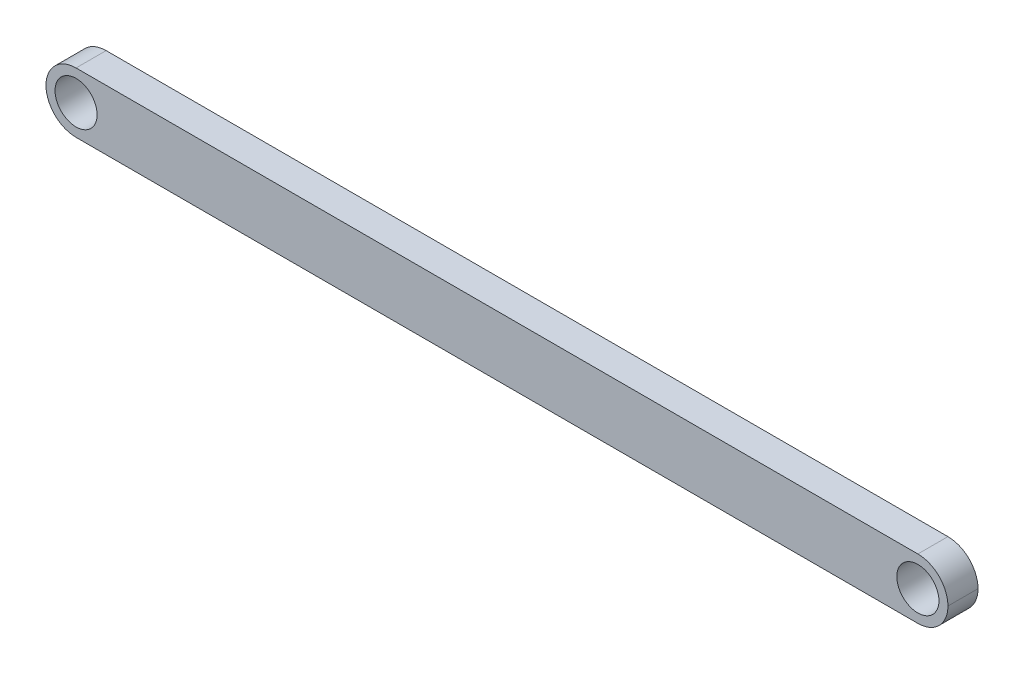
from build123d import *

# Parameters (mm, degrees)
SKETCH_1_W      = 300
SKETCH_1_H      = 20
SKETCH_1_R      = 7
EXTRUDE_1_DEPTH = 10
FILLET_1_R      = 10


with BuildPart() as part:
    # 草图1 → 凸台-拉伸1 (new body)
    with BuildSketch(Plane.XY):
        Rectangle(SKETCH_1_W, SKETCH_1_H)
        with Locations((-140, 0)):
            Circle(SKETCH_1_R, mode=Mode.SUBTRACT)
        with Locations((140, 0)):
            Circle(SKETCH_1_R, mode=Mode.SUBTRACT)
    extrude(amount=EXTRUDE_1_DEPTH)

    # 圆角1
    fillet_1_edges = [part.edges().sort_by_distance(p)[0] for p in [
        (150, 10, 5),
        (150, -10, 5),
        (-150, -10, 5),
        (-150, 10, 5),
    ]]
    fillet(fillet_1_edges, radius=FILLET_1_R - 0.0001)  # a hair under: the kernel refuses the full size


solid = part.part
